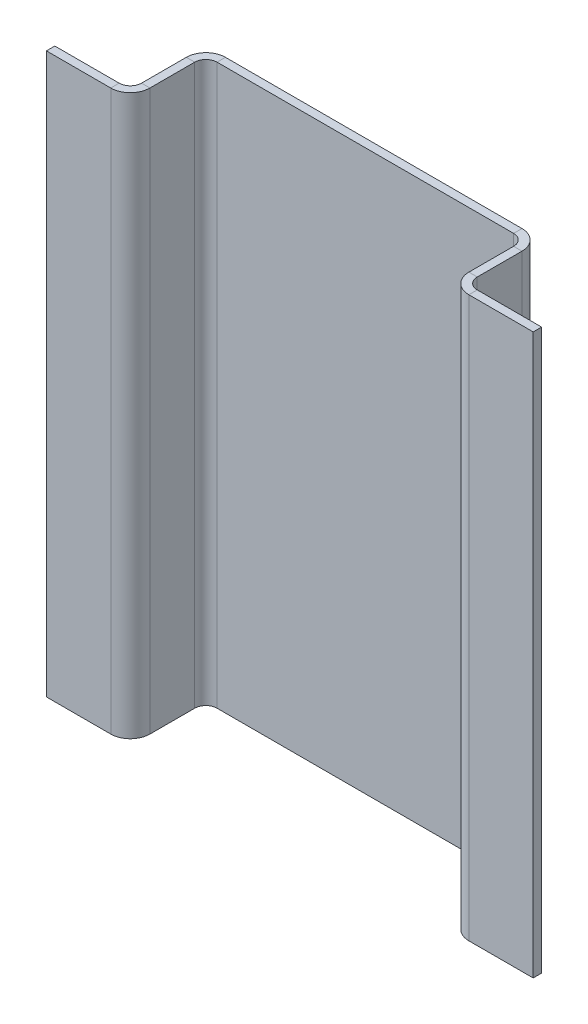
from build123d import *

# Parameters (mm, degrees)
SKETCH_1_W                         = 60
SKETCH_1_H                         = 100
SM_BASE_FLANGE_1_DEPTH             = 1.5
SM_EDGE_FLANGE_1_STRIP_W           = 10
SM_EDGE_FLANGE_1_STRIP_H           = 1.5
SM_EDGE_FLANGE_1_STRIP_CUT_DEPTH   = 100
SM_EDGE_FLANGE_1_STRIP_2_W         = 10
SM_EDGE_FLANGE_1_STRIP_2_H         = 1.5
SM_EDGE_FLANGE_1_STRIP_CUT_2_DEPTH = 100
SM_EDGE_FLANGE_1_DEPTH             = 100
SM_EDGE_FLANGE_1_BEND_DEPTH        = 100
SM_EDGE_FLANGE_2_STRIP_W           = 10
SM_EDGE_FLANGE_2_STRIP_H           = 1.5
SM_EDGE_FLANGE_2_STRIP_CUT_DEPTH   = 100
SM_EDGE_FLANGE_2_STRIP_2_W         = 10
SM_EDGE_FLANGE_2_STRIP_2_H         = 1.5
SM_EDGE_FLANGE_2_STRIP_CUT_2_DEPTH = 100
SM_EDGE_FLANGE_2_DEPTH             = 100
SM_EDGE_FLANGE_2_BEND_DEPTH        = 100


# Sheet-metal steps are written as plain solids
with BuildPart() as part:
    # Sketch 1 → 基体-法兰1 (new body)
    with BuildSketch(Plane.XY):
        Rectangle(SKETCH_1_W, SKETCH_1_H)
    extrude(amount=-SM_BASE_FLANGE_1_DEPTH)

    # 边线-法兰1 strip (across the edge) → 边线-法兰1 strip cut (cut)
    with BuildSketch(Plane(origin=(-30, 50, 0), x_dir=(1, 0, 0), z_dir=(0, -1, 0))):
        with Locations((-1.5, -0.75)):
            Rectangle(SM_EDGE_FLANGE_1_STRIP_W, SM_EDGE_FLANGE_1_STRIP_H)
    extrude(amount=SM_EDGE_FLANGE_1_STRIP_CUT_DEPTH, mode=Mode.SUBTRACT)

    # 边线-法兰1 strip 2 (across the edge) → 边线-法兰1 strip cut 2 (cut)
    with BuildSketch(Plane(origin=(30, -50, 0), x_dir=(-1, 0, 0), z_dir=(0, 1, 0))):
        with Locations((-1.5, -0.75)):
            Rectangle(SM_EDGE_FLANGE_1_STRIP_2_W, SM_EDGE_FLANGE_1_STRIP_2_H)
    extrude(amount=SM_EDGE_FLANGE_1_STRIP_CUT_2_DEPTH, mode=Mode.SUBTRACT)

    # 边线-法兰1 section (across the edge) → 边线-法兰1 (add)
    with BuildSketch(Plane(origin=(-30, 50, 0), x_dir=(1, 0, 0), z_dir=(0, -1, 0))):
        with BuildLine():
            Line((0, 2), (0, 13.5))
            Line((0, 13.5), (1.5, 13.5))
            Line((1.5, 13.5), (1.5, 2))
            ThreePointArc((1.5, 2), (2.085786438, 0.585786438), (3.5, 0))
            Line((3.5, 0), (3.5, -1.5))
            ThreePointArc((3.5, -1.5), (1.025126266, -0.474873734), (0, 2))
        make_face()
    extrude(amount=SM_EDGE_FLANGE_1_DEPTH)

    # 边线-法兰1 section 2 (across the edge) → 边线-法兰1 bend (add)
    with BuildSketch(Plane(origin=(30, -50, 0), x_dir=(-1, 0, 0), z_dir=(0, 1, 0))):
        with BuildLine():
            Line((0, 2), (0, 13.5))
            Line((0, 13.5), (1.5, 13.5))
            Line((1.5, 13.5), (1.5, 2))
            ThreePointArc((1.5, 2), (2.085786438, 0.585786438), (3.5, 0))
            Line((3.5, 0), (3.5, -1.5))
            ThreePointArc((3.5, -1.5), (1.025126266, -0.474873734), (0, 2))
        make_face()
    extrude(amount=SM_EDGE_FLANGE_1_BEND_DEPTH)

    # 边线-法兰2 strip (across the edge) → 边线-法兰2 strip cut (cut)
    with BuildSketch(Plane(origin=(-30, -50, 13.5), x_dir=(0, 0, -1), z_dir=(0, 1, 0))):
        with Locations((-1.5, -0.75)):
            Rectangle(SM_EDGE_FLANGE_2_STRIP_W, SM_EDGE_FLANGE_2_STRIP_H)
    extrude(amount=SM_EDGE_FLANGE_2_STRIP_CUT_DEPTH, mode=Mode.SUBTRACT)

    # 边线-法兰2 strip 2 (across the edge) → 边线-法兰2 strip cut 2 (cut)
    with BuildSketch(Plane(origin=(30, 50, 13.5), x_dir=(0, 0, -1), z_dir=(0, -1, 0))):
        with Locations((-1.5, -0.75)):
            Rectangle(SM_EDGE_FLANGE_2_STRIP_2_W, SM_EDGE_FLANGE_2_STRIP_2_H)
    extrude(amount=SM_EDGE_FLANGE_2_STRIP_CUT_2_DEPTH, mode=Mode.SUBTRACT)

    # 边线-法兰2 section (across the edge) → 边线-法兰2 (add)
    with BuildSketch(Plane(origin=(-30, -50, 13.5), x_dir=(0, 0, -1), z_dir=(0, 1, 0))):
        with BuildLine():
            Line((0, 2), (0, 13.5))
            Line((0, 13.5), (1.5, 13.5))
            Line((1.5, 13.5), (1.5, 2))
            ThreePointArc((1.5, 2), (2.085786438, 0.585786438), (3.5, 0))
            Line((3.5, 0), (3.5, -1.5))
            ThreePointArc((3.5, -1.5), (1.025126266, -0.474873734), (0, 2))
        make_face()
    extrude(amount=SM_EDGE_FLANGE_2_DEPTH)

    # 边线-法兰2 section 2 (across the edge) → 边线-法兰2 bend (add)
    with BuildSketch(Plane(origin=(30, 50, 13.5), x_dir=(0, 0, -1), z_dir=(0, -1, 0))):
        with BuildLine():
            Line((0, 2), (0, 13.5))
            Line((0, 13.5), (1.5, 13.5))
            Line((1.5, 13.5), (1.5, 2))
            ThreePointArc((1.5, 2), (2.085786438, 0.585786438), (3.5, 0))
            Line((3.5, 0), (3.5, -1.5))
            ThreePointArc((3.5, -1.5), (1.025126266, -0.474873734), (0, 2))
        make_face()
    extrude(amount=SM_EDGE_FLANGE_2_BEND_DEPTH)


solid = part.part
